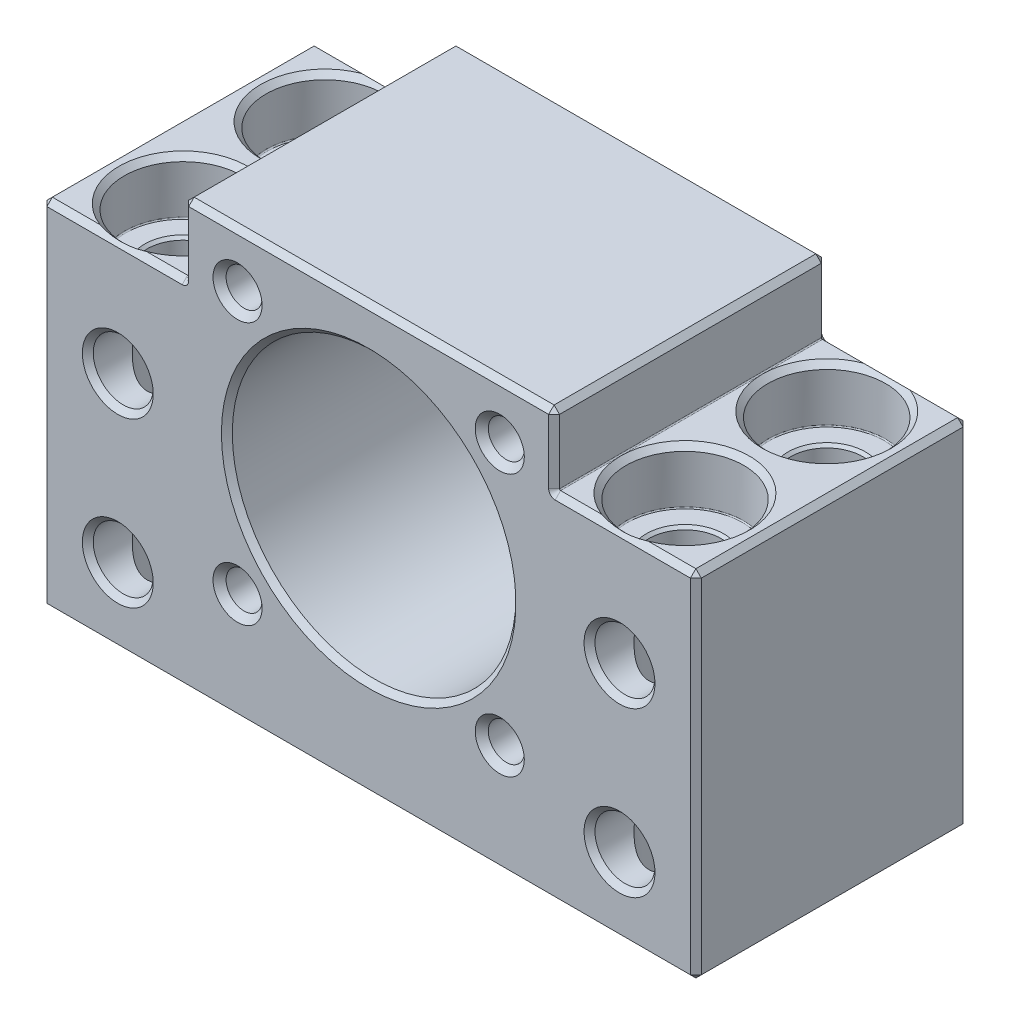
from build123d import *

# Parameters (mm, degrees)
BK_BODY_DEPTH               = 12.5
BK_FLANGE_DEPTH             = 40.246018906
BK_FLANGE_DEPTH_BACK        = 40.246018906
BK_B_FLANGE_R               = 11
BK_B_HOLE_R                 = 13
BK_B_HOLE_R_2               = 11
BK_BEARING_DEPTH            = 20
VERTICAL_HOLES_AT_2_COUNT   = 2
VERTICAL_HOLES_AT_2_PITCH   = 13
VERTICAL_HOLES_AT_3_COUNT   = 2
VERTICAL_HOLES_AT_3_PITCH   = 46
VERTICAL_HOLES_AT_4_COUNT   = 2
VERTICAL_HOLES_AT_4_PITCH   = 47.801673611
HORIZONTAL_HOLES_AT_2_COUNT = 2
HORIZONTAL_HOLES_AT_2_PITCH = 15
HORIZONTAL_HOLES_AT_3_COUNT = 2
HORIZONTAL_HOLES_AT_3_PITCH = 46
HORIZONTAL_HOLES_AT_4_COUNT = 2
HORIZONTAL_HOLES_AT_4_PITCH = 48.383881614
FLANGE_HOLES_D              = 3.3
FLANGE_HOLES_DEPTH          = 11.5
FLANGE_HOLES_CSINK_D        = 4.5
FLANGE_HOLES_CSINK_ANGLE    = 90
FLANGE_HOLES_TIP            = 0.991420021
BEARING_FILLET_R            = 0.15
PRODUCTION_FILLET_R         = 0.1


# Some blends are built 0.0001 mm under size
with BuildPart() as part:
    # BK Body Sketch → BK Body (new, symmetric)
    with BuildSketch(Plane.XY):
        Polygon((30, -22), (-30, -22), (-30, 10.5), (-17, 10.5), (-17, 17), (17, 17), (17, 10.5), (30, 10.5), align=None)
    extrude(amount=BK_BODY_DEPTH, both=True)

    # BK B-Flange → BK Flange (cut, two sides: drawn at the far end of the back side and taken through both)
    with BuildSketch(Plane.XY.offset(-BK_FLANGE_DEPTH_BACK)):
        Circle(BK_B_FLANGE_R)
    extrude(amount=BK_FLANGE_DEPTH + BK_FLANGE_DEPTH_BACK, mode=Mode.SUBTRACT)

    # BK B-Hole → BK Bearing (cut)
    with BuildSketch(Plane.XY.offset(12.5)):
        Circle(BK_B_HOLE_R)
        Circle(BK_B_HOLE_R_2, mode=Mode.SUBTRACT)
    extrude(amount=-BK_BEARING_DEPTH, mode=Mode.SUBTRACT)

    # Sketch2 → Vertical Holes (revolve, cut)
    with BuildSketch(Plane(origin=(-23, 10.5, -6.5), x_dir=(0, 0, 1), z_dir=(1, 0, 0))):
        Polygon((0, 0), (0, 32.5), (3.8, 32.5), (3.3, 32), (3.3, 5.25), (3.55, 5), (5.4, 5), (5.4, 0.5), (5.9, 0), align=None)
    vertical_holes = revolve(axis=Axis((-23, 16.85, -6.5), (0, -1, 0)), mode=Mode.SUBTRACT)

    # Vertical Holes at 2: Vertical Holes ×2
    with Locations(*[(0, 0, i * VERTICAL_HOLES_AT_2_PITCH) for i in range(1, VERTICAL_HOLES_AT_2_COUNT)]):
        add(vertical_holes, mode=Mode.SUBTRACT)

    # Vertical Holes at 3: Vertical Holes ×2
    with Locations(*[(i * VERTICAL_HOLES_AT_3_PITCH, 0, 0) for i in range(1, VERTICAL_HOLES_AT_3_COUNT)]):
        add(vertical_holes, mode=Mode.SUBTRACT)

    # Vertical Holes at 4: Vertical Holes ×2
    with Locations(*[Vector(0.9623094031071993, 0, 0.2719570052259475) * (i * VERTICAL_HOLES_AT_4_PITCH) for i in range(1, VERTICAL_HOLES_AT_4_COUNT)]):
        add(vertical_holes, mode=Mode.SUBTRACT)

    # Sketch4 → Horizontal Holes (revolve, cut)
    with BuildSketch(Plane(origin=(-23, 0, 12.5), x_dir=(0, -1, 0), z_dir=(1, 0, 0))):
        Polygon((0, 0), (0, 25), (3.25, 25), (2.75, 24.5), (2.75, 0.5), (3.25, 0), align=None)
    horizontal_holes = revolve(axis=Axis((-23, 0, 18.85), (0, 0, -1)), mode=Mode.SUBTRACT)

    # Horizontal Holes at 2: Horizontal Holes ×2
    with Locations(*[(0, -i * HORIZONTAL_HOLES_AT_2_PITCH, 0) for i in range(1, HORIZONTAL_HOLES_AT_2_COUNT)]):
        add(horizontal_holes, mode=Mode.SUBTRACT)

    # Horizontal Holes at 3: Horizontal Holes ×2
    with Locations(*[(i * HORIZONTAL_HOLES_AT_3_PITCH, 0, 0) for i in range(1, HORIZONTAL_HOLES_AT_3_COUNT)]):
        add(horizontal_holes, mode=Mode.SUBTRACT)

    # Horizontal Holes at 4: Horizontal Holes ×2
    with Locations(*[Vector(0.9507298394814789, -0.31002059983091673, 0) * (i * HORIZONTAL_HOLES_AT_4_PITCH) for i in range(1, HORIZONTAL_HOLES_AT_4_COUNT)]):
        add(horizontal_holes, mode=Mode.SUBTRACT)

    # Flange Holes
    with Locations(Plane.XY.offset(12.5)):
        with Locations((-12.02081528, 12.02081528), (12.02081528, 12.02081528), (12.02081528, -12.02081528), (-12.02081528, -12.02081528)):
            CounterSinkHole(FLANGE_HOLES_D / 2, FLANGE_HOLES_CSINK_D / 2, depth=FLANGE_HOLES_DEPTH, counter_sink_angle=FLANGE_HOLES_CSINK_ANGLE)
            with Locations((0, 0, -(FLANGE_HOLES_DEPTH + FLANGE_HOLES_TIP / 2))):  # 118° drill point
                Cone(0, FLANGE_HOLES_D / 2, FLANGE_HOLES_TIP, mode=Mode.SUBTRACT)

    # Bearing Fillet
    bearing_fillet_edges = [part.edges().sort_by_distance(p)[0] for p in [
        (-13, 0, -7.5),
    ]]
    fillet(bearing_fillet_edges, radius=BEARING_FILLET_R)

    # Production Fillet
    production_fillet_edges = [part.edges().sort_by_distance(p)[0] for p in [
        (-17, 10.5, 0),
        (17, 10.5, 0),
        (23, 5.5, 1.1),
        (23, 5.5, -11.9),
        (-23, 5.5, 1.1),
        (-23, 5.5, -11.9),
    ]]
    fillet(production_fillet_edges, radius=PRODUCTION_FILLET_R - 0.0001)  # a hair under: the kernel refuses the full size

    # Aesthetic Chamfer
    # the kernel refuses this chamfer: 0.5 mm, written as the material it takes off along each edge
    with BuildSketch(Plane(origin=(29.666666667, 10.166666667, -12.166666667), x_dir=(0, -0.7071067811865475, -0.7071067811865475), z_dir=(0.5773502691896258, 0.5773502691896258, -0.5773502691896258)), Plane(origin=(29.666666667, -21.666666667, -12.166666667), x_dir=(0, -0.7071067811865475, 0.7071067811865475), z_dir=(0.5773502691896258, -0.5773502691896258, -0.5773502691896258)), Plane(origin=(-16.666666667, 16.666666667, 12.166666667), x_dir=(-0.7071067811865475, 0, -0.7071067811865475), z_dir=(-0.5773502691896258, 0.5773502691896258, 0.5773502691896258)), Plane(origin=(-29.666666667, 10.166666667, -12.166666667), x_dir=(-0.7071067811865475, -0.7071067811865475, 0), z_dir=(-0.5773502691896258, 0.5773502691896258, -0.5773502691896258)), Plane(origin=(-16.666666667, 16.666666667, -12.166666667), x_dir=(0.7071067811865475, 0, -0.7071067811865475), z_dir=(-0.5773502691896258, 0.5773502691896258, -0.5773502691896258)), Plane(origin=(29.666666667, 10.166666667, 12.166666667), x_dir=(0, 0.7071067811865475, -0.7071067811865475), z_dir=(0.5773502691896258, 0.5773502691896258, 0.5773502691896258))) as aesthetic_chamfer_piece_1:
        Polygon((-0.353553391, 0.204124145), (0.353553391, 0.204124145), (0, -0.40824829), align=None)
    extrude(amount=0.635085296, mode=Mode.SUBTRACT)
    with BuildSketch(Plane(origin=(16.666666667, 16.666666667, 12.166666667), x_dir=(0.7071067811865475, 0, -0.7071067811865475), z_dir=(0.5773502691896258, 0.5773502691896258, 0.5773502691896258)), Plane(origin=(29.666666667, -21.666666667, 12.166666667), x_dir=(0, -0.7071067811865475, -0.7071067811865475), z_dir=(0.5773502691896258, -0.5773502691896258, 0.5773502691896258)), Plane(origin=(-29.666666667, -21.666666667, 12.166666667), x_dir=(-0.7071067811865475, 0, -0.7071067811865475), z_dir=(-0.5773502691896258, -0.5773502691896258, 0.5773502691896258)), Plane(origin=(-29.666666667, -21.666666667, -12.166666667), x_dir=(0.7071067811865475, 0, -0.7071067811865475), z_dir=(-0.5773502691896258, -0.5773502691896258, -0.5773502691896258)), Plane(origin=(-29.666666667, 10.166666667, 12.166666667), x_dir=(0, 0.7071067811865475, -0.7071067811865475), z_dir=(-0.5773502691896258, 0.5773502691896258, 0.5773502691896258)), Plane(origin=(16.666666667, 16.666666667, -12.166666667), x_dir=(-0.7071067811865475, 0, -0.7071067811865475), z_dir=(0.5773502691896258, 0.5773502691896258, -0.5773502691896258))) as aesthetic_chamfer_piece_2:
        Polygon((-0.353553391, -0.204124145), (0.353553391, -0.204124145), (0, 0.40824829), align=None)
    extrude(amount=0.635085296, mode=Mode.SUBTRACT)
    with BuildSketch(Plane(origin=(17.0999, 10.5, -12.5), x_dir=(0, 0.027495876610585647, 0.9996219169112968), z_dir=(1, 0, 0)), Plane(origin=(-31.285841494, 10.5, -12.5), x_dir=(0, 0.027495876610585647, 0.9996219169112968), z_dir=(1, 0, 0)), Plane(origin=(-31.285841494, 10.5, 12.5), x_dir=(0, -0.9996219169112968, 0.027495876610585647), z_dir=(1, 0, 0)), Plane(origin=(17.0999, 10.5, 12.5), x_dir=(0, -0.9996219169112968, 0.027495876610585647), z_dir=(1, 0, 0))) as aesthetic_chamfer_piece_3:
        with BuildLine():
            Line((0.514336598, 0), (-0.028273577, 0.513558897))
            Line((-0.028273577, 0.513558897), (-0.038269797, 0.513283938))
            ThreePointArc((-0.038269797, 0.513283938), (-0.017064614, 0.256698915), (-0.009996219, -0.000274959))
            Line((-0.009996219, -0.000274959), (0.000274959, -0.009996219))
            ThreePointArc((0.000274959, -0.009996219), (0.257248832, -0.002927825), (0.514611556, -0.009996219))
            Line((0.514611556, -0.009996219), (0.514336598, 0))
        make_face()
    extrude(amount=14.185941494, mode=Mode.SUBTRACT)
    with BuildSketch(Plane(origin=(30, 11.785841494, -12.5), x_dir=(0.0274958766105891, 0, 0.9996219169112968), z_dir=(0, -1, 0)), Plane(origin=(-30, -23.285841494, 12.5), x_dir=(0.9996219169112968, 0, 0.02749587661058555), z_dir=(0, 1, 0)), Plane(origin=(30, 11.785841494, 12.5), x_dir=(-0.9996219169112968, 0, 0.02749587661058555), z_dir=(0, -1, 0)), Plane(origin=(-30, -23.285841494, -12.5), x_dir=(-0.0274958766105891, 0, 0.9996219169112968), z_dir=(0, 1, 0))) as aesthetic_chamfer_piece_4:
        with BuildLine():
            Line((0.514336598, 0), (-0.028273577, 0.513558897))
            Line((-0.028273577, 0.513558897), (-0.038269797, 0.513283938))
            ThreePointArc((-0.038269797, 0.513283938), (-0.017064614, 0.256698915), (-0.009996219, -0.000274959))
            Line((-0.009996219, -0.000274959), (0.000274959, -0.009996219))
            ThreePointArc((0.000274959, -0.009996219), (0.257248832, -0.002927825), (0.514611556, -0.009996219))
            Line((0.514611556, -0.009996219), (0.514336598, 0))
        make_face()
    extrude(amount=35.071682988, mode=Mode.SUBTRACT)
    with BuildSketch(Plane(origin=(-18.285841494, 17, 12.5), x_dir=(0, -0.9996219169112968, 0.02749587661058555), z_dir=(1, 0, 0)), Plane(origin=(-18.285841494, 17, -12.5), x_dir=(0, 0.0274958766105891, 0.9996219169112968), z_dir=(1, 0, 0))) as aesthetic_chamfer_piece_5:
        with BuildLine():
            Line((0.514336598, 0), (-0.028273577, 0.513558897))
            Line((-0.028273577, 0.513558897), (-0.038269797, 0.513283938))
            ThreePointArc((-0.038269797, 0.513283938), (-0.017064614, 0.256698915), (-0.009996219, -0.000274959))
            Line((-0.009996219, -0.000274959), (0.000274959, -0.009996219))
            ThreePointArc((0.000274959, -0.009996219), (0.257248832, -0.002927825), (0.514611556, -0.009996219))
            Line((0.514611556, -0.009996219), (0.514336598, 0))
        make_face()
    extrude(amount=36.571682988, mode=Mode.SUBTRACT)
    with BuildSketch(Plane(origin=(30, -22, -13.785841494), x_dir=(-0.9996219169112968, -0.027495876610589005, 0), z_dir=(0, 0, 1)), Plane(origin=(-17, 17, 13.785841494), x_dir=(-0.027495876610589005, -0.9996219169112968, 0), z_dir=(0, 0, -1)), Plane(origin=(17, 17, 13.785841494), x_dir=(-0.9996219169112968, 0.027495876610589005, 0), z_dir=(0, 0, -1)), Plane(origin=(30, 10.5, -13.785841494), x_dir=(0.0274958766105891, -0.9996219169112968, 0), z_dir=(0, 0, 1))) as aesthetic_chamfer_piece_6:
        with BuildLine():
            Line((0.514336598, 0), (-0.028273577, -0.513558897))
            Line((-0.028273577, -0.513558897), (-0.038269797, -0.513283938))
            ThreePointArc((-0.038269797, -0.513283938), (-0.017064614, -0.256698915), (-0.009996219, 0.000274959))
            Line((-0.009996219, 0.000274959), (0.000274959, 0.009996219))
            ThreePointArc((0.000274959, 0.009996219), (0.257248832, 0.002927825), (0.514611556, 0.009996219))
            Line((0.514611556, 0.009996219), (0.514336598, 0))
        make_face()
    extrude(amount=27.571682988, mode=Mode.SUBTRACT)
    with BuildSketch(Plane(origin=(-30, -22, 13.785841494), x_dir=(-0.027495876610589005, 0.9996219169112968, 0), z_dir=(0, 0, -1)), Plane(origin=(-30, 10.5, 13.785841494), x_dir=(0.9996219169112968, 0.02749587661058555, 0), z_dir=(0, 0, -1))) as aesthetic_chamfer_piece_7:
        with BuildLine():
            Line((0.514336598, 0), (-0.028273577, 0.513558897))
            Line((-0.028273577, 0.513558897), (-0.038269797, 0.513283938))
            ThreePointArc((-0.038269797, 0.513283938), (-0.017064614, 0.256698915), (-0.009996219, -0.000274959))
            Line((-0.009996219, -0.000274959), (0.000274959, -0.009996219))
            ThreePointArc((0.000274959, -0.009996219), (0.257248832, -0.002927825), (0.514611556, -0.009996219))
            Line((0.514611556, -0.009996219), (0.514336598, 0))
        make_face()
    extrude(amount=27.571682988, mode=Mode.SUBTRACT)
    with BuildSketch(Plane(origin=(-17, 10.5999, 12.5), x_dir=(0.9996219169112968, 0, 0.02749587661058555), z_dir=(0, 1, 0)), Plane(origin=(17, 18.285841494, -12.5), x_dir=(0.0274958766105891, 0, 0.9996219169112968), z_dir=(0, -1, 0)), Plane(origin=(17, 18.285841494, 12.5), x_dir=(-0.9996219169112968, 0, 0.02749587661058555), z_dir=(0, -1, 0)), Plane(origin=(-17, 10.5999, -12.5), x_dir=(-0.0274958766105891, 0, 0.9996219169112968), z_dir=(0, 1, 0))) as aesthetic_chamfer_piece_8:
        with BuildLine():
            Line((0.514336598, 0), (-0.028273577, 0.513558897))
            Line((-0.028273577, 0.513558897), (-0.038269797, 0.513283938))
            ThreePointArc((-0.038269797, 0.513283938), (-0.017064614, 0.256698915), (-0.009996219, -0.000274959))
            Line((-0.009996219, -0.000274959), (0.000274959, -0.009996219))
            ThreePointArc((0.000274959, -0.009996219), (0.257248832, -0.002927825), (0.514611556, -0.009996219))
            Line((0.514611556, -0.009996219), (0.514336598, 0))
        make_face()
    extrude(amount=7.685941494, mode=Mode.SUBTRACT)
    with BuildSketch(Plane(origin=(-17.0999, 10.5999, -12.5), x_dir=(0, -1, 0), z_dir=(-1, 0, 0))) as aesthetic_chamfer_piece_9:
        with BuildLine():
            Line((0.085757864, 0.514142136), (0.614042136, -0.014142136))
            Line((0.614042136, -0.014142136), (0.614042136, -0.024142136))
            ThreePointArc((0.614042136, -0.024142136), (0.356971068, -0.01), (0.0999, -0.01))
            Line((0.0999, -0.01), (0.0899, 0))
            ThreePointArc((0.0899, 0), (0.0899, 0.257071068), (0.075757864, 0.514142136))
            Line((0.075757864, 0.514142136), (0.085757864, 0.514142136))
        make_face()
    revolve(axis=Axis((-17.0999, 10.5999, -12.5), (0, 0, 1)), revolution_arc=90, mode=Mode.SUBTRACT)
    with BuildSketch(Plane(origin=(-17.0999, 10.5999, 12.5), x_dir=(0, -1, 0), z_dir=(-1, 0, 0))) as aesthetic_chamfer_piece_10:
        with BuildLine():
            Line((0.614042136, 0.014142136), (0.085757864, -0.514142136))
            Line((0.085757864, -0.514142136), (0.075757864, -0.514142136))
            ThreePointArc((0.075757864, -0.514142136), (0.0899, -0.257071068), (0.0899, 0))
            Line((0.0899, 0), (0.0999, 0.01))
            ThreePointArc((0.0999, 0.01), (0.356971068, 0.01), (0.614042136, 0.024142136))
            Line((0.614042136, 0.024142136), (0.614042136, 0.014142136))
        make_face()
    revolve(axis=Axis((-17.0999, 10.5999, 12.5), (0, 0, 1)), revolution_arc=90, mode=Mode.SUBTRACT)
    with BuildSketch(Plane(origin=(17.0999, 10.5999, -12.5), x_dir=(-1, 0, 0), z_dir=(0, 1, 0))) as aesthetic_chamfer_piece_11:
        with BuildLine():
            Line((0.085757864, 0.514142136), (0.614042136, -0.014142136))
            Line((0.614042136, -0.014142136), (0.614042136, -0.024142136))
            ThreePointArc((0.614042136, -0.024142136), (0.356971068, -0.01), (0.0999, -0.01))
            Line((0.0999, -0.01), (0.0899, 0))
            ThreePointArc((0.0899, 0), (0.0899, 0.257071068), (0.075757864, 0.514142136))
            Line((0.075757864, 0.514142136), (0.085757864, 0.514142136))
        make_face()
    revolve(axis=Axis((17.0999, 10.5999, -12.5), (0, 0, 1)), revolution_arc=90, mode=Mode.SUBTRACT)
    with BuildSketch(Plane(origin=(17.0999, 10.5999, 12.5), x_dir=(-1, 0, 0), z_dir=(0, 1, 0))) as aesthetic_chamfer_piece_12:
        with BuildLine():
            Line((0.614042136, 0.014142136), (0.085757864, -0.514142136))
            Line((0.085757864, -0.514142136), (0.075757864, -0.514142136))
            ThreePointArc((0.075757864, -0.514142136), (0.0899, -0.257071068), (0.0899, 0))
            Line((0.0899, 0), (0.0999, 0.01))
            ThreePointArc((0.0999, 0.01), (0.356971068, 0.01), (0.614042136, 0.024142136))
            Line((0.614042136, 0.024142136), (0.614042136, 0.014142136))
        make_face()
    revolve(axis=Axis((17.0999, 10.5999, 12.5), (0, 0, 1)), revolution_arc=90, mode=Mode.SUBTRACT)
    with BuildSketch(Plane(origin=(0, 0, -12.5), x_dir=(1, 0, 0), z_dir=(0, -1, 0))) as aesthetic_chamfer_piece_13:
        with BuildLine():
            Line((11.514142136, -0.014142136), (10.985857864, 0.514142136))
            Line((10.985857864, 0.514142136), (10.975857864, 0.514142136))
            ThreePointArc((10.975857864, 0.514142136), (10.99, 0.257071068), (10.99, 0))
            Line((10.99, 0), (11, -0.01))
            ThreePointArc((11, -0.01), (11.257071068, -0.01), (11.514142136, -0.024142136))
            Line((11.514142136, -0.024142136), (11.514142136, -0.014142136))
        make_face()
    revolve(axis=Axis((0, 0, -12.5), (0, 0, 1)), mode=Mode.SUBTRACT)
    with BuildSketch(Plane(origin=(31.285841494, -22, 12.5), x_dir=(0, 0.9996219169112968, 0.02749587661058555), z_dir=(-1, 0, 0)), Plane(origin=(31.285841494, -22, -12.5), x_dir=(0, -0.0274958766105891, 0.9996219169112968), z_dir=(-1, 0, 0))) as aesthetic_chamfer_piece_14:
        with BuildLine():
            Line((0.514336598, 0), (-0.028273577, 0.513558897))
            Line((-0.028273577, 0.513558897), (-0.038269797, 0.513283938))
            ThreePointArc((-0.038269797, 0.513283938), (-0.017064614, 0.256698915), (-0.009996219, -0.000274959))
            Line((-0.009996219, -0.000274959), (0.000274959, -0.009996219))
            ThreePointArc((0.000274959, -0.009996219), (0.257248832, -0.002927825), (0.514611556, -0.009996219))
            Line((0.514611556, -0.009996219), (0.514336598, 0))
        make_face()
    extrude(amount=62.571682988, mode=Mode.SUBTRACT)
    with BuildSketch(Plane(origin=(0, 0, 12.5), x_dir=(1, 0, 0), z_dir=(0, -1, 0))) as aesthetic_chamfer_piece_15:
        with BuildLine():
            Line((13.514142136, 0.014142136), (12.985857864, -0.514142136))
            Line((12.985857864, -0.514142136), (12.975857864, -0.514142136))
            ThreePointArc((12.975857864, -0.514142136), (12.99, -0.257071068), (12.99, 0))
            Line((12.99, 0), (13, 0.01))
            ThreePointArc((13, 0.01), (13.257071068, 0.01), (13.514142136, 0.024142136))
            Line((13.514142136, 0.024142136), (13.514142136, 0.014142136))
        make_face()
    revolve(axis=Axis((0, 0, 12.5), (0, 0, 1)), mode=Mode.SUBTRACT)
    with BuildSketch(Plane(origin=(0, 0, -7.5), x_dir=(1, 0, 0), z_dir=(0, -1, 0))) as aesthetic_chamfer_piece_16:
        with BuildLine():
            Line((10.985857864, -0.514142136), (11.514142136, 0.014142136))
            Line((11.514142136, 0.014142136), (11.514142136, 0.024142136))
            ThreePointArc((11.514142136, 0.024142136), (11.257071068, 0.01), (11, 0.01))
            Line((11, 0.01), (10.99, 0))
            ThreePointArc((10.99, 0), (10.99, -0.257071068), (10.975857864, -0.514142136))
            Line((10.975857864, -0.514142136), (10.985857864, -0.514142136))
        make_face()
    revolve(axis=Axis((0, 0, -7.5), (0, 0, 1)), mode=Mode.SUBTRACT)


solid = part.part
